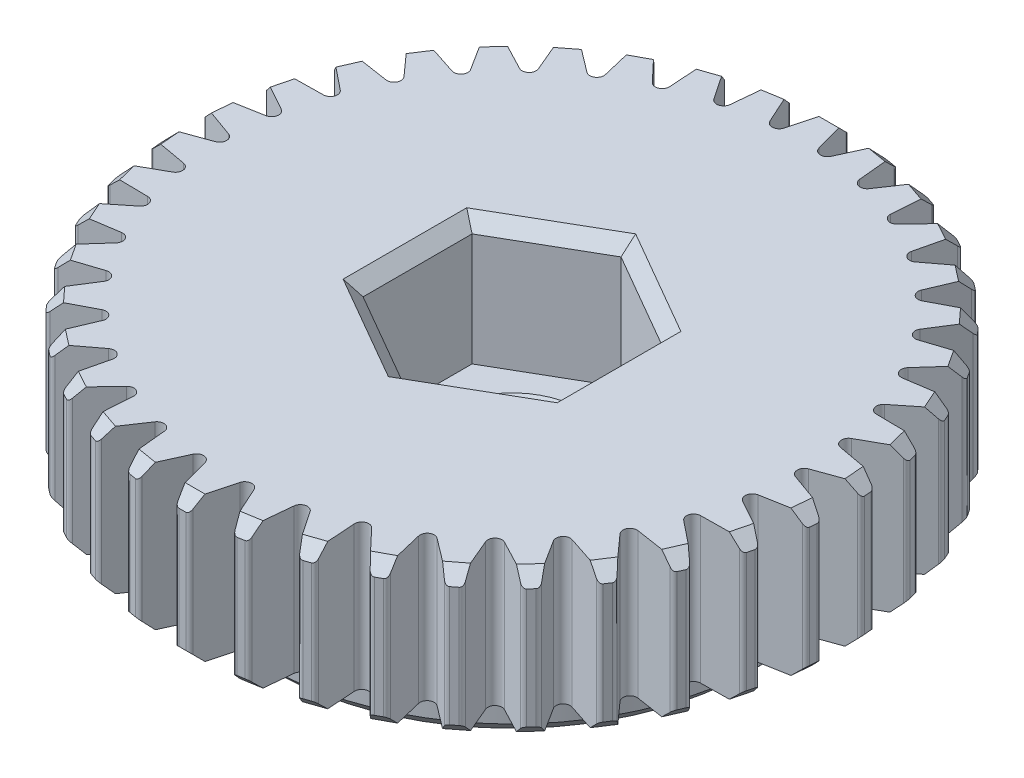
from build123d import *

# Parameters (mm, degrees)
SKETCH1_R                    = 17.4625
BOSS_EXTRUDE1_DEPTH          = 8.73125
BOSS_EXTRUDE3_DEPTH          = 8.73125
CHAMFER3_SIZE                = 0.762
FILLET3_R                    = 0.25
CIRPATTERN2_COUNT            = 38
CHAMFER3_OF_CIRPATTERN2_SIZE = 0.762
FILLET3_OF_CIRPATTERN2_R     = 0.25
SKETCH4_R                    = 0.424691146
CUT_EXTRUDE1_DEPTH           = 30.356465481
CIRPATTERN6_COUNT            = 38
SKETCH3_R                    = 15.113
BOSS_EXTRUDE4_DEPTH          = 3.175
CHAMFER1_SIZE                = 0.762
BOSS_EXTRUDE5_DEPTH          = 4.365625


with BuildPart() as part:
    # Sketch1 → Boss-Extrude1 (new body)
    with BuildSketch(Plane(origin=(0, 0, 0), x_dir=(1, 0, 0), z_dir=(0, 1, 0))):
        with Locations(Location((0, 0, 0), (0, 0, 270))):
            Circle(SKETCH1_R)
        Polygon((-5.68325, 3.281225917), (-5.68325, -3.281225917), (0, -6.562451835), (5.68325, -3.281225917), (5.68325, 3.281225917), (0, 6.562451835), align=None, mode=Mode.SUBTRACT)
    extrude(amount=BOSS_EXTRUDE1_DEPTH)

    # Sketch2 → Boss-Extrude3 (add, through all)
    with BuildSketch(Plane(origin=(0, 8.73125, 0), x_dir=(1, 0, 0), z_dir=(0, 1, 0))):
        Polygon((-0.396875, 19.84375), (0.396875, 19.84375), (1.043287197, 17.431306838), (0, 17.4625), (-1.043287197, 17.431306838), align=None)
    boss_extrude3 = extrude(amount=-BOSS_EXTRUDE3_DEPTH)

    # Chamfer3
    chamfer3_edges = [part.edges().sort_by_distance(p)[0] for p in [
        (0, 0, -19.84375),
        (0, 8.73125, -19.84375),
    ]]
    chamfer(chamfer3_edges, length=CHAMFER3_SIZE)

    # Fillet3
    fillet3_edges = [part.edges().sort_by_distance(p)[0] for p in [
        (0.396875, 4.365625, -19.84375),
        (-0.396875, 4.365625, -19.84375),
    ]]
    fillet(fillet3_edges, radius=FILLET3_R)

    # CirPattern2: Boss-Extrude3 ×38 about axis
    cirpattern2_axis = Axis((0, 0, 0), (0, 1, 0))
    for i in range(1, CIRPATTERN2_COUNT):
        add(boss_extrude3.rotate(cirpattern2_axis, i * 360 / CIRPATTERN2_COUNT))

    # Chamfer3 of CirPattern2
    chamfer3_of_cirpattern2_edges = [part.edges().sort_by_distance(p)[0] for p in [
        (-3.266173901, 0, -19.573107114),
        (-3.266173901, 8.73125, -19.573107114),
        (-6.443255092, 0, -18.76856089),
        (-6.443255092, 8.73125, -18.76856089),
        (-9.444581081, 0, -17.452057251),
        (-9.444581081, 8.73125, -17.452057251),
        (-12.188283517, 0, -15.659506983),
        (-12.188283517, 8.73125, -15.659506983),
        (-14.599521352, 0, -13.439806187),
        (-14.599521352, 8.73125, -13.439806187),
        (-16.612522303, 0, -10.853502513),
        (-16.612522303, 8.73125, -10.853502513),
        (-18.172376951, 0, -7.971143583),
        (-18.172376951, 8.73125, -7.971143583),
        (-19.236536527, 0, -4.871352635),
        (-19.236536527, 8.73125, -4.871352635),
        (-19.775973533, 0, -1.638683887),
        (-19.775973533, 8.73125, -1.638683887),
        (-19.775973533, 0, 1.638683887),
        (-19.775973533, 8.73125, 1.638683887),
        (-19.236536527, 0, 4.871352635),
        (-19.236536527, 8.73125, 4.871352635),
        (-18.172376951, 0, 7.971143583),
        (-18.172376951, 8.73125, 7.971143583),
        (-16.612522303, 0, 10.853502513),
        (-16.612522303, 8.73125, 10.853502513),
        (-14.599521352, 0, 13.439806187),
        (-14.599521352, 8.73125, 13.439806187),
        (-12.188283517, 0, 15.659506983),
        (-12.188283517, 8.73125, 15.659506983),
        (-9.444581081, 0, 17.452057251),
        (-9.444581081, 8.73125, 17.452057251),
        (-6.443255092, 0, 18.76856089),
        (-6.443255092, 8.73125, 18.76856089),
        (-3.266173901, 0, 19.573107114),
        (-3.266173901, 8.73125, 19.573107114),
        (0, 0, 19.84375),
        (0, 8.73125, 19.84375),
        (3.266173901, 0, 19.573107114),
        (3.266173901, 8.73125, 19.573107114),
        (6.443255092, 0, 18.76856089),
        (6.443255092, 8.73125, 18.76856089),
        (9.444581081, 0, 17.452057251),
        (9.444581081, 8.73125, 17.452057251),
        (12.188283517, 0, 15.659506983),
        (12.188283517, 8.73125, 15.659506983),
        (14.599521352, 0, 13.439806187),
        (14.599521352, 8.73125, 13.439806187),
        (16.612522303, 0, 10.853502513),
        (16.612522303, 8.73125, 10.853502513),
        (18.172376951, 0, 7.971143583),
        (18.172376951, 8.73125, 7.971143583),
        (19.236536527, 0, 4.871352635),
        (19.236536527, 8.73125, 4.871352635),
        (19.775973533, 0, 1.638683887),
        (19.775973533, 8.73125, 1.638683887),
        (19.775973533, 0, -1.638683887),
        (19.775973533, 8.73125, -1.638683887),
        (19.236536527, 0, -4.871352635),
        (19.236536527, 8.73125, -4.871352635),
        (18.172376951, 0, -7.971143583),
        (18.172376951, 8.73125, -7.971143583),
        (16.612522303, 0, -10.853502513),
        (16.612522303, 8.73125, -10.853502513),
        (14.599521352, 0, -13.439806187),
        (14.599521352, 8.73125, -13.439806187),
        (12.188283517, 0, -15.659506983),
        (12.188283517, 8.73125, -15.659506983),
        (9.444581081, 0, -17.452057251),
        (9.444581081, 8.73125, -17.452057251),
        (6.443255092, 0, -18.76856089),
        (6.443255092, 8.73125, -18.76856089),
        (3.266173901, 0, -19.573107114),
        (3.266173901, 8.73125, -19.573107114),
    ]]
    chamfer(chamfer3_of_cirpattern2_edges, length=CHAMFER3_OF_CIRPATTERN2_SIZE)

    # Fillet3 of CirPattern2
    fillet3_of_cirpattern2_edges = [part.edges().sort_by_distance(p)[0] for p in [
        (-2.874711759, 4.365625, -19.638430592),
        (-3.657636043, 4.365625, -19.507783636),
        (-6.067883874, 4.365625, -18.897425992),
        (-6.81862631, 4.365625, -18.639695788),
        (-9.095539936, 4.365625, -17.640948872),
        (-9.793622226, 4.365625, -17.263165629),
        (-11.875093378, 4.365625, -15.903272654),
        (-12.501473657, 4.365625, -15.415741313),
        (-14.330725229, 4.365625, -13.731796614),
        (-14.868317476, 4.365625, -13.14781576),
        (-16.395452253, 4.365625, -11.185752959),
        (-16.829592353, 4.365625, -10.521252067),
        (-18.012954079, 4.365625, -8.334591122),
        (-18.331799822, 4.365625, -7.607696044),
        (-19.139109475, 4.365625, -5.256083366),
        (-19.33396358, 4.365625, -4.486621905),
        (-19.743199855, 4.365625, -2.034203357),
        (-19.808747211, 4.365625, -1.243164416),
        (-19.808747211, 4.365625, 1.243164416),
        (-19.743199855, 4.365625, 2.034203357),
        (-19.33396358, 4.365625, 4.486621905),
        (-19.139109475, 4.365625, 5.256083366),
        (-18.331799822, 4.365625, 7.607696044),
        (-18.012954079, 4.365625, 8.334591122),
        (-16.829592353, 4.365625, 10.521252067),
        (-16.395452253, 4.365625, 11.185752959),
        (-14.868317476, 4.365625, 13.14781576),
        (-14.330725229, 4.365625, 13.731796614),
        (-12.501473657, 4.365625, 15.415741313),
        (-11.875093378, 4.365625, 15.903272654),
        (-9.793622226, 4.365625, 17.263165629),
        (-9.095539936, 4.365625, 17.640948872),
        (-6.81862631, 4.365625, 18.639695788),
        (-6.067883874, 4.365625, 18.897425992),
        (-3.657636043, 4.365625, 19.507783636),
        (-2.874711759, 4.365625, 19.638430592),
        (-0.396875, 4.365625, 19.84375),
        (0.396875, 4.365625, 19.84375),
        (2.874711759, 4.365625, 19.638430592),
        (3.657636043, 4.365625, 19.507783636),
        (6.067883874, 4.365625, 18.897425992),
        (6.81862631, 4.365625, 18.639695788),
        (9.095539936, 4.365625, 17.640948872),
        (9.793622226, 4.365625, 17.263165629),
        (11.875093378, 4.365625, 15.903272654),
        (12.501473657, 4.365625, 15.415741313),
        (14.330725229, 4.365625, 13.731796614),
        (14.868317476, 4.365625, 13.14781576),
        (16.395452253, 4.365625, 11.185752959),
        (16.829592353, 4.365625, 10.521252067),
        (18.012954079, 4.365625, 8.334591122),
        (18.331799822, 4.365625, 7.607696044),
        (19.139109475, 4.365625, 5.256083366),
        (19.33396358, 4.365625, 4.486621905),
        (19.743199855, 4.365625, 2.034203357),
        (19.808747211, 4.365625, 1.243164416),
        (19.808747211, 4.365625, -1.243164416),
        (19.743199855, 4.365625, -2.034203357),
        (19.33396358, 4.365625, -4.486621905),
        (19.139109475, 4.365625, -5.256083366),
        (18.331799822, 4.365625, -7.607696044),
        (18.012954079, 4.365625, -8.334591122),
        (16.829592353, 4.365625, -10.521252067),
        (16.395452253, 4.365625, -11.185752959),
        (14.868317476, 4.365625, -13.14781576),
        (14.330725229, 4.365625, -13.731796614),
        (12.501473657, 4.365625, -15.415741313),
        (11.875093378, 4.365625, -15.903272654),
        (9.793622226, 4.365625, -17.263165629),
        (9.095539936, 4.365625, -17.640948872),
        (6.81862631, 4.365625, -18.639695788),
        (6.067883874, 4.365625, -18.897425992),
        (3.657636043, 4.365625, -19.507783636),
        (2.874711759, 4.365625, -19.638430592),
    ]]
    fillet(fillet3_of_cirpattern2_edges, radius=FILLET3_OF_CIRPATTERN2_R)

    # Sketch4 → Cut-Extrude1 (cut, through all)
    with BuildSketch(Plane(origin=(0, 8.73125, 0), x_dir=(1, 0, 0), z_dir=(0, 1, 0))):
        with Locations((1.453507343, 17.541224995)):
            Circle(SKETCH4_R)
    cut_extrude1 = extrude(amount=-CUT_EXTRUDE1_DEPTH, mode=Mode.SUBTRACT)

    # CirPattern6: Cut-Extrude1 ×38 about axis
    cirpattern6_axis = Axis((0, 0, 0), (0, 1, 0))
    for i in range(1, CIRPATTERN6_COUNT):
        add(cut_extrude1.rotate(cirpattern6_axis, i * 360 / CIRPATTERN6_COUNT), mode=Mode.SUBTRACT)

    # Sketch3 → Boss-Extrude4 (add)
    with BuildSketch(Plane.XZ):
        with Locations(Location((0, 0, 0), (0, 0, 90))):
            Circle(SKETCH3_R)
        Polygon((-5.68325, -3.281225917), (0, -6.562451835), (5.68325, -3.281225917), (5.68325, 3.281225917), (0, 6.562451835), (-5.68325, 3.281225917), align=None, mode=Mode.SUBTRACT)
    extrude(amount=BOSS_EXTRUDE4_DEPTH)

    # Chamfer1
    chamfer1_edges = [part.edges().sort_by_distance(p)[0] for p in [
        (-2.841625, 8.73125, -4.921838876),
        (-5.68325, 8.73125, 0),
        (-2.841625, 8.73125, 4.921838876),
        (2.841625, 8.73125, 4.921838876),
        (5.68325, 8.73125, 0),
        (2.841625, 8.73125, -4.921838876),
        (0, -3.175, -15.113),
    ]]
    chamfer(chamfer1_edges, length=CHAMFER1_SIZE)

    # Sketch5 → Boss-Extrude5 (add)
    with BuildSketch(Plane.XZ.offset(3.175)):
        Polygon((5.68325, -3.281225917), (5.68325, 3.281225917), (0, 6.562451835), (-5.68325, 3.281225917), (-5.68325, -3.281225917), (0, -6.562451835), align=None)
    extrude(amount=-BOSS_EXTRUDE5_DEPTH)

    # Sketch8 → 1/4 Clearance Hole1 (revolve, cut)
    with BuildSketch(Plane(origin=(0, -3.175, 0), x_dir=(0, 0, -1), z_dir=(1, 0, 0))):
        Polygon((0, 0), (0, 4.365625), (4.20624, 4.365625), (3.57124, 3.730625), (3.57124, 0.635), (4.20624, 0), align=None)
    revolve(axis=Axis((0, -9.525, 0), (0, 1, 0)), mode=Mode.SUBTRACT)


solid = part.part
